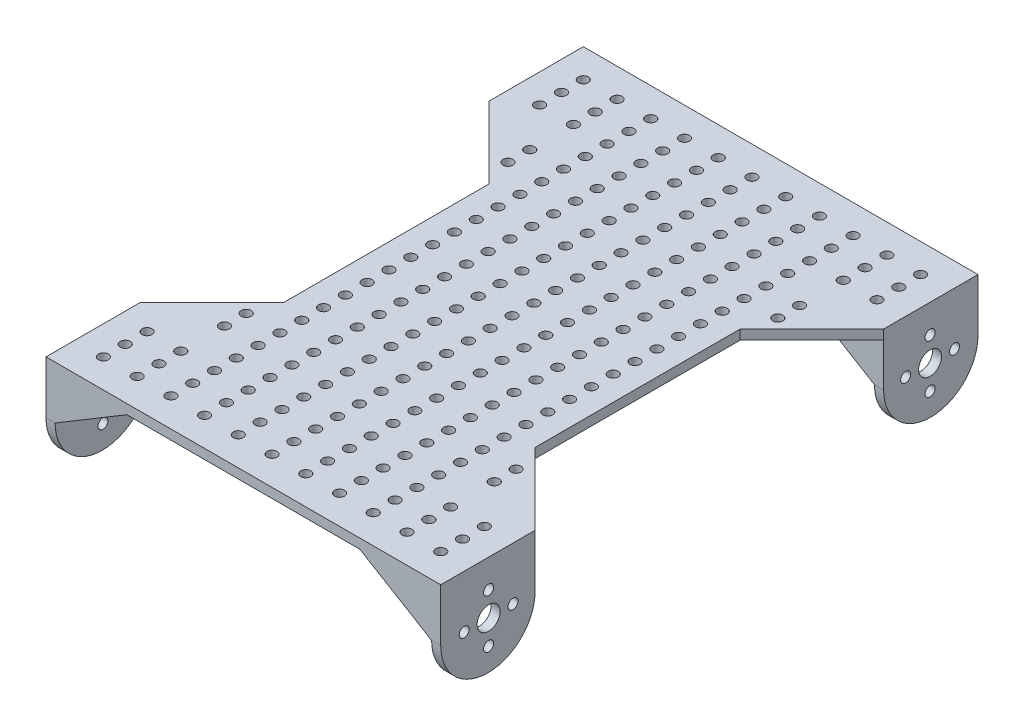
from build123d import *

# Parameters (mm, degrees)
CROQUIS1_R                   = 13.2
CROQUIS1_R_2                 = 4
CROQUIS1_R_3                 = 1.75
SALIENTE_EXTRUIR1_DEPTH      = 3.175
SALIENTE_EXTRUIR2_DEPTH      = 131.175
SALIENTE_EXTRUIR2_DEPTH_BACK = 3.175
CROQUIS3_W                   = 187.2
CROQUIS3_H                   = 3.36816026
CROQUIS4_R                   = 1.75
CROQUIS4_R_2                 = 4
SALIENTE_EXTRUIR3_DEPTH      = 3.175
CORTAR_EXTRUIR1_DEPTH        = 170.959965606
SALIENTE_EXTRUIR4_START      = -187.2
SALIENTE_EXTRUIR4_DEPTH      = 187.2
CORTAR_EXTRUIR2_START        = -65.5875
CROQUIS9_W                   = 26.9
CROQUIS9_H                   = 15
CROQUIS9_W_2                 = 121.4
CORTAR_EXTRUIR2_DEPTH        = 131.175
CROQUIS10_R                  = 1.75
CORTAR_EXTRUIR3_DEPTH        = 170.959965606


with BuildPart() as part:
    # Croquis1 → Saliente-Extruir1 (new body)
    # profile 1 of 3: a face of its own
    with BuildSketch(Plane(origin=(0, 0, 0), x_dir=(0, 0, -1), z_dir=(1, 0, 0))):
        with BuildLine():
            ThreePointArc((93.6, -15), (77.15, -31.45), (60.7, -15))
            Line((60.7, -15), (60.7, 0))
            Line((60.7, 0), (-60.7, 0))
            Line((-60.7, 0), (-60.7, -15))
            ThreePointArc((-60.7, -15), (-77.15, -31.45), (-93.6, -15))
            Line((-93.6, -15), (-93.6, 0))
            Line((-93.6, 0), (-93.6, 3.36816026))
            Line((-93.6, 3.36816026), (93.6, 3.36816026))
            Line((93.6, 3.36816026), (93.6, 0))
            Line((93.6, 0), (93.6, -15))
        make_face()
        with Locations((-76.9, -15)):
            Circle(CROQUIS1_R, mode=Mode.SUBTRACT)
        with Locations((76.9, -15)):
            Circle(CROQUIS1_R, mode=Mode.SUBTRACT)
    # profile 2 of 3: a face of its own
    with BuildSketch(Plane(origin=(0, 0, 0), x_dir=(0, 0, -1), z_dir=(1, 0, 0))):
        with Locations((-76.9, -15)):
            Circle(CROQUIS1_R)
        with Locations((-76.9, -15)):
            Circle(CROQUIS1_R_2, mode=Mode.SUBTRACT)
        with Locations((-76.9, -6.5)):
            Circle(CROQUIS1_R_3, mode=Mode.SUBTRACT)
        with Locations((-68.4, -15)):
            Circle(CROQUIS1_R_3, mode=Mode.SUBTRACT)
        with Locations((-85.4, -15)):
            Circle(CROQUIS1_R_3, mode=Mode.SUBTRACT)
        with Locations((-76.9, -23.5)):
            Circle(CROQUIS1_R_3, mode=Mode.SUBTRACT)
    # profile 3 of 3: a face of its own
    with BuildSketch(Plane(origin=(0, 0, 0), x_dir=(0, 0, -1), z_dir=(1, 0, 0))):
        with Locations((76.9, -15)):
            Circle(CROQUIS1_R)
        with Locations((76.9, -23.5)):
            Circle(CROQUIS1_R_3, mode=Mode.SUBTRACT)
        with Locations((68.4, -15)):
            Circle(CROQUIS1_R_3, mode=Mode.SUBTRACT)
        with Locations((76.9, -6.5)):
            Circle(CROQUIS1_R_3, mode=Mode.SUBTRACT)
        with Locations((85.4, -15)):
            Circle(CROQUIS1_R_3, mode=Mode.SUBTRACT)
        with Locations((76.9, -15)):
            Circle(CROQUIS1_R_2, mode=Mode.SUBTRACT)
    extrude(amount=SALIENTE_EXTRUIR1_DEPTH)

    # Croquis3 → Saliente-Extruir2 (add, two sides: drawn at the far end of the back side and taken through both)
    with BuildSketch(Plane(origin=(3.175, 0, 0), x_dir=(0, 0, -1), z_dir=(1, 0, 0)).offset(-SALIENTE_EXTRUIR2_DEPTH_BACK)):
        with Locations((0, 1.68408013)):
            Rectangle(CROQUIS3_W, CROQUIS3_H)
    extrude(amount=SALIENTE_EXTRUIR2_DEPTH + SALIENTE_EXTRUIR2_DEPTH_BACK)

    # Croquis4 → Saliente-Extruir3 (add)
    # profile 1 of 3: a face of its own
    with BuildSketch(Plane(origin=(134.35, 0, 0), x_dir=(0, 0, -1), z_dir=(1, 0, 0))):
        with BuildLine():
            Line((-60.7, 0), (-93.6, 0))
            Line((-93.6, 0), (-93.6, -15))
            ThreePointArc((-93.6, -15), (-77.15, -31.45), (-60.7, -15))
            Line((-60.7, -15), (-60.7, 0))
        make_face()
        with Locations((-76.9, -23.5)):
            Circle(CROQUIS4_R, mode=Mode.SUBTRACT)
        with Locations((-85.4, -15)):
            Circle(CROQUIS4_R, mode=Mode.SUBTRACT)
        with Locations((-76.9, -15)):
            Circle(CROQUIS4_R_2, mode=Mode.SUBTRACT)
        with Locations((-68.4, -15)):
            Circle(CROQUIS4_R, mode=Mode.SUBTRACT)
        with Locations((-76.9, -6.5)):
            Circle(CROQUIS4_R, mode=Mode.SUBTRACT)
    # profile 2 of 3: a face of its own
    with BuildSketch(Plane(origin=(134.35, 0, 0), x_dir=(0, 0, -1), z_dir=(1, 0, 0))):
        Polygon((93.6, 0), (93.6, 3.36816026), (-93.6, 3.36816026), (-93.6, 0), (-60.7, 0), (60.7, 0), align=None)
    # profile 3 of 3: a face of its own
    with BuildSketch(Plane(origin=(134.35, 0, 0), x_dir=(0, 0, -1), z_dir=(1, 0, 0))):
        with BuildLine():
            Line((93.6, -15), (93.6, 0))
            Line((93.6, 0), (60.7, 0))
            Line((60.7, 0), (60.7, -15))
            ThreePointArc((60.7, -15), (77.15, -31.45), (93.6, -15))
        make_face()
        with Locations((76.9, -23.5)):
            Circle(CROQUIS4_R, mode=Mode.SUBTRACT)
        with Locations((68.4, -15)):
            Circle(CROQUIS4_R, mode=Mode.SUBTRACT)
        with Locations((76.9, -15)):
            Circle(CROQUIS4_R_2, mode=Mode.SUBTRACT)
        with Locations((85.4, -15)):
            Circle(CROQUIS4_R, mode=Mode.SUBTRACT)
        with Locations((76.9, -6.5)):
            Circle(CROQUIS4_R, mode=Mode.SUBTRACT)
    extrude(amount=SALIENTE_EXTRUIR3_DEPTH)

    # Croquis5 → Cortar-Extruir1 (cut, through all)
    with BuildSketch(Plane(origin=(0, 3.36816026, 0), x_dir=(1, 0, 0), z_dir=(0, 1, 0))):
        Polygon((0, 60.7), (25, 35.7), (25, -35.7), (0, -60.7), align=None)
        Polygon((137.525, 60.7), (112.525, 35.7), (112.525, -35.7), (137.525, -60.7), align=None)
    extrude(amount=-CORTAR_EXTRUIR1_DEPTH, mode=Mode.SUBTRACT)

    # Croquis8 → Saliente-Extruir4 (add)
    with BuildSketch(Plane.XY.offset(93.6).offset(SALIENTE_EXTRUIR4_START)):
        Polygon((3.175, -15), (28.175, 0), (3.175, 0), align=None)
        Polygon((134.35, 0), (134.35, -15), (109.35, 0), align=None)
    extrude(amount=SALIENTE_EXTRUIR4_DEPTH)

    # Croquis9 → Cortar-Extruir2 (cut)
    with BuildSketch(Plane(origin=(68.7625, 0, 0), x_dir=(0, 0, -1), z_dir=(1, 0, 0)).offset(CORTAR_EXTRUIR2_START)):
        with Locations((-77.15, -7.5)):
            Rectangle(CROQUIS9_W, CROQUIS9_H)
        with Locations((0, -7.5)):
            Rectangle(CROQUIS9_W_2, CROQUIS9_H)
        with Locations((77.15, -7.5)):
            Rectangle(CROQUIS9_W, CROQUIS9_H)
    extrude(amount=CORTAR_EXTRUIR2_DEPTH, mode=Mode.SUBTRACT)

    # Croquis10 → Cortar-Extruir3 (cut, through all)
    with BuildSketch(Plane(origin=(0, 3.36816026, 0), x_dir=(1, 0, 0), z_dir=(0, 1, 0))):
        with Locations(Location((10, 83.6, 0), (0, 0, 270))):
            Circle(CROQUIS10_R)
        with Locations((127.525, 83.6)):
            Circle(CROQUIS10_R)
        with Locations(Location((21.753, 83.6, 0), (0, 0, 270))):
            Circle(CROQUIS10_R)
        with Locations(Location((33.506, 83.6, 0), (0, 0, 270))):
            Circle(CROQUIS10_R)
        with Locations(Location((45.259, 83.6, 0), (0, 0, 270))):
            Circle(CROQUIS10_R)
        with Locations(Location((57.012, 83.6, 0), (0, 0, 270))):
            Circle(CROQUIS10_R)
        with Locations(Location((68.765, 83.6, 0), (0, 0, 270))):
            Circle(CROQUIS10_R)
        with Locations(Location((80.518, 83.6, 0), (0, 0, 270))):
            Circle(CROQUIS10_R)
        with Locations(Location((92.271, 83.6, 0), (0, 0, 270))):
            Circle(CROQUIS10_R)
        with Locations(Location((104.024, 83.6, 0), (0, 0, 270))):
            Circle(CROQUIS10_R)
        with Locations(Location((115.777, 83.6, 0), (0, 0, 270))):
            Circle(CROQUIS10_R)
        with Locations((127.53, 83.6)):
            Circle(CROQUIS10_R)
        with Locations(Location((10, -83.6, 0), (0, 0, 270))):
            Circle(CROQUIS10_R)
        with Locations(Location((10, 76, 0), (0, 0, 270))):
            Circle(CROQUIS10_R)
        with Locations((127.525, 76)):
            Circle(CROQUIS10_R)
        with Locations(Location((21.753, 76, 0), (0, 0, 270))):
            Circle(CROQUIS10_R)
        with Locations(Location((33.506, 76, 0), (0, 0, 270))):
            Circle(CROQUIS10_R)
        with Locations(Location((45.259, 76, 0), (0, 0, 270))):
            Circle(CROQUIS10_R)
        with Locations(Location((57.012, 76, 0), (0, 0, 270))):
            Circle(CROQUIS10_R)
        with Locations(Location((68.765, 76, 0), (0, 0, 270))):
            Circle(CROQUIS10_R)
        with Locations(Location((80.518, 76, 0), (0, 0, 270))):
            Circle(CROQUIS10_R)
        with Locations(Location((92.271, 76, 0), (0, 0, 270))):
            Circle(CROQUIS10_R)
        with Locations(Location((104.024, 76, 0), (0, 0, 270))):
            Circle(CROQUIS10_R)
        with Locations(Location((115.777, 76, 0), (0, 0, 270))):
            Circle(CROQUIS10_R)
        with Locations((127.53, 76)):
            Circle(CROQUIS10_R)
        with Locations(Location((10, 68.4, 0), (0, 0, 270))):
            Circle(CROQUIS10_R)
        with Locations((127.525, 68.4)):
            Circle(CROQUIS10_R)
        with Locations(Location((21.753, 68.4, 0), (0, 0, 270))):
            Circle(CROQUIS10_R)
        with Locations(Location((33.506, 68.4, 0), (0, 0, 270))):
            Circle(CROQUIS10_R)
        with Locations(Location((45.259, 68.4, 0), (0, 0, 270))):
            Circle(CROQUIS10_R)
        with Locations(Location((57.012, 68.4, 0), (0, 0, 270))):
            Circle(CROQUIS10_R)
        with Locations(Location((68.765, 68.4, 0), (0, 0, 270))):
            Circle(CROQUIS10_R)
        with Locations(Location((80.518, 68.4, 0), (0, 0, 270))):
            Circle(CROQUIS10_R)
        with Locations(Location((92.271, 68.4, 0), (0, 0, 270))):
            Circle(CROQUIS10_R)
        with Locations(Location((104.024, 68.4, 0), (0, 0, 270))):
            Circle(CROQUIS10_R)
        with Locations(Location((115.777, 68.4, 0), (0, 0, 270))):
            Circle(CROQUIS10_R)
        with Locations((127.53, 68.4)):
            Circle(CROQUIS10_R)
        with Locations(Location((33.506, 60.8, 0), (0, 0, 270))):
            Circle(CROQUIS10_R)
        with Locations(Location((45.259, 60.8, 0), (0, 0, 270))):
            Circle(CROQUIS10_R)
        with Locations(Location((57.012, 60.8, 0), (0, 0, 270))):
            Circle(CROQUIS10_R)
        with Locations(Location((68.765, 60.8, 0), (0, 0, 270))):
            Circle(CROQUIS10_R)
        with Locations(Location((80.518, 60.8, 0), (0, 0, 270))):
            Circle(CROQUIS10_R)
        with Locations(Location((92.271, 60.8, 0), (0, 0, 270))):
            Circle(CROQUIS10_R)
        with Locations(Location((104.024, 60.8, 0), (0, 0, 270))):
            Circle(CROQUIS10_R)
        with Locations(Location((21.753, 53.2, 0), (0, 0, 270))):
            Circle(CROQUIS10_R)
        with Locations(Location((33.506, 53.2, 0), (0, 0, 270))):
            Circle(CROQUIS10_R)
        with Locations(Location((45.259, 53.2, 0), (0, 0, 270))):
            Circle(CROQUIS10_R)
        with Locations(Location((57.012, 53.2, 0), (0, 0, 270))):
            Circle(CROQUIS10_R)
        with Locations(Location((68.765, 53.2, 0), (0, 0, 270))):
            Circle(CROQUIS10_R)
        with Locations(Location((80.518, 53.2, 0), (0, 0, 270))):
            Circle(CROQUIS10_R)
        with Locations(Location((92.271, 53.2, 0), (0, 0, 270))):
            Circle(CROQUIS10_R)
        with Locations(Location((104.024, 53.2, 0), (0, 0, 270))):
            Circle(CROQUIS10_R)
        with Locations(Location((115.777, 53.2, 0), (0, 0, 270))):
            Circle(CROQUIS10_R)
        with Locations((10, 45.6)):
            Circle(CROQUIS10_R)
        with Locations((127.525, 45.6)):
            Circle(CROQUIS10_R)
        with Locations(Location((21.753, 45.6, 0), (0, 0, 270))):
            Circle(CROQUIS10_R)
        with Locations(Location((33.506, 45.6, 0), (0, 0, 270))):
            Circle(CROQUIS10_R)
        with Locations(Location((45.259, 45.6, 0), (0, 0, 270))):
            Circle(CROQUIS10_R)
        with Locations(Location((57.012, 45.6, 0), (0, 0, 270))):
            Circle(CROQUIS10_R)
        with Locations(Location((68.765, 45.6, 0), (0, 0, 270))):
            Circle(CROQUIS10_R)
        with Locations(Location((80.518, 45.6, 0), (0, 0, 270))):
            Circle(CROQUIS10_R)
        with Locations(Location((92.271, 45.6, 0), (0, 0, 270))):
            Circle(CROQUIS10_R)
        with Locations(Location((104.024, 45.6, 0), (0, 0, 270))):
            Circle(CROQUIS10_R)
        with Locations(Location((115.777, 45.6, 0), (0, 0, 270))):
            Circle(CROQUIS10_R)
        with Locations((127.53, 45.6)):
            Circle(CROQUIS10_R)
        with Locations((10, 38)):
            Circle(CROQUIS10_R)
        with Locations((127.525, 38)):
            Circle(CROQUIS10_R)
        with Locations(Location((33.506, 38, 0), (0, 0, 270))):
            Circle(CROQUIS10_R)
        with Locations(Location((45.259, 38, 0), (0, 0, 270))):
            Circle(CROQUIS10_R)
        with Locations(Location((57.012, 38, 0), (0, 0, 270))):
            Circle(CROQUIS10_R)
        with Locations(Location((68.765, 38, 0), (0, 0, 270))):
            Circle(CROQUIS10_R)
        with Locations(Location((80.518, 38, 0), (0, 0, 270))):
            Circle(CROQUIS10_R)
        with Locations(Location((92.271, 38, 0), (0, 0, 270))):
            Circle(CROQUIS10_R)
        with Locations(Location((104.024, 38, 0), (0, 0, 270))):
            Circle(CROQUIS10_R)
        with Locations((127.53, 38)):
            Circle(CROQUIS10_R)
        with Locations((10, 30.4)):
            Circle(CROQUIS10_R)
        with Locations((127.525, 30.4)):
            Circle(CROQUIS10_R)
        with Locations((21.753, 30.4)):
            Circle(CROQUIS10_R)
        with Locations(Location((33.506, 30.4, 0), (0, 0, 270))):
            Circle(CROQUIS10_R)
        with Locations(Location((45.259, 30.4, 0), (0, 0, 270))):
            Circle(CROQUIS10_R)
        with Locations(Location((57.012, 30.4, 0), (0, 0, 270))):
            Circle(CROQUIS10_R)
        with Locations(Location((68.765, 30.4, 0), (0, 0, 270))):
            Circle(CROQUIS10_R)
        with Locations(Location((80.518, 30.4, 0), (0, 0, 270))):
            Circle(CROQUIS10_R)
        with Locations(Location((92.271, 30.4, 0), (0, 0, 270))):
            Circle(CROQUIS10_R)
        with Locations(Location((104.024, 30.4, 0), (0, 0, 270))):
            Circle(CROQUIS10_R)
        with Locations((115.777, 30.4)):
            Circle(CROQUIS10_R)
        with Locations((127.53, 30.4)):
            Circle(CROQUIS10_R)
        with Locations((10, 22.8)):
            Circle(CROQUIS10_R)
        with Locations((127.525, 22.8)):
            Circle(CROQUIS10_R)
        with Locations((21.753, 22.8)):
            Circle(CROQUIS10_R)
        with Locations(Location((33.506, 22.8, 0), (0, 0, 270))):
            Circle(CROQUIS10_R)
        with Locations(Location((45.259, 22.8, 0), (0, 0, 270))):
            Circle(CROQUIS10_R)
        with Locations(Location((57.012, 22.8, 0), (0, 0, 270))):
            Circle(CROQUIS10_R)
        with Locations(Location((68.765, 22.8, 0), (0, 0, 270))):
            Circle(CROQUIS10_R)
        with Locations(Location((80.518, 22.8, 0), (0, 0, 270))):
            Circle(CROQUIS10_R)
        with Locations(Location((92.271, 22.8, 0), (0, 0, 270))):
            Circle(CROQUIS10_R)
        with Locations(Location((104.024, 22.8, 0), (0, 0, 270))):
            Circle(CROQUIS10_R)
        with Locations((115.777, 22.8)):
            Circle(CROQUIS10_R)
        with Locations((127.53, 22.8)):
            Circle(CROQUIS10_R)
        with Locations((10, 15.2)):
            Circle(CROQUIS10_R)
        with Locations((127.525, 15.2)):
            Circle(CROQUIS10_R)
        with Locations((21.753, 15.2)):
            Circle(CROQUIS10_R)
        with Locations(Location((33.506, 15.2, 0), (0, 0, 270))):
            Circle(CROQUIS10_R)
        with Locations(Location((45.259, 15.2, 0), (0, 0, 270))):
            Circle(CROQUIS10_R)
        with Locations(Location((57.012, 15.2, 0), (0, 0, 270))):
            Circle(CROQUIS10_R)
        with Locations(Location((68.765, 15.2, 0), (0, 0, 270))):
            Circle(CROQUIS10_R)
        with Locations(Location((80.518, 15.2, 0), (0, 0, 270))):
            Circle(CROQUIS10_R)
        with Locations(Location((92.271, 15.2, 0), (0, 0, 270))):
            Circle(CROQUIS10_R)
        with Locations(Location((104.024, 15.2, 0), (0, 0, 270))):
            Circle(CROQUIS10_R)
        with Locations((115.777, 15.2)):
            Circle(CROQUIS10_R)
        with Locations((127.53, 15.2)):
            Circle(CROQUIS10_R)
        with Locations((10, 7.6)):
            Circle(CROQUIS10_R)
        with Locations((127.525, 7.6)):
            Circle(CROQUIS10_R)
        with Locations((21.753, 7.6)):
            Circle(CROQUIS10_R)
        with Locations(Location((33.506, 7.6, 0), (0, 0, 270))):
            Circle(CROQUIS10_R)
        with Locations(Location((45.259, 7.6, 0), (0, 0, 270))):
            Circle(CROQUIS10_R)
        with Locations(Location((57.012, 7.6, 0), (0, 0, 270))):
            Circle(CROQUIS10_R)
        with Locations(Location((68.765, 7.6, 0), (0, 0, 270))):
            Circle(CROQUIS10_R)
        with Locations(Location((80.518, 7.6, 0), (0, 0, 270))):
            Circle(CROQUIS10_R)
        with Locations(Location((92.271, 7.6, 0), (0, 0, 270))):
            Circle(CROQUIS10_R)
        with Locations(Location((104.024, 7.6, 0), (0, 0, 270))):
            Circle(CROQUIS10_R)
        with Locations((115.777, 7.6)):
            Circle(CROQUIS10_R)
        with Locations((127.53, 7.6)):
            Circle(CROQUIS10_R)
        with Locations((10, 0)):
            Circle(CROQUIS10_R)
        with Locations((127.525, 0)):
            Circle(CROQUIS10_R)
        with Locations((21.753, 0)):
            Circle(CROQUIS10_R)
        with Locations(Location((33.506, 0, 0), (0, 0, 270))):
            Circle(CROQUIS10_R)
        with Locations(Location((45.259, 0, 0), (0, 0, 270))):
            Circle(CROQUIS10_R)
        with Locations(Location((57.012, 0, 0), (0, 0, 270))):
            Circle(CROQUIS10_R)
        with Locations(Location((68.765, 0, 0), (0, 0, 270))):
            Circle(CROQUIS10_R)
        with Locations(Location((80.518, 0, 0), (0, 0, 270))):
            Circle(CROQUIS10_R)
        with Locations(Location((92.271, 0, 0), (0, 0, 270))):
            Circle(CROQUIS10_R)
        with Locations(Location((104.024, 0, 0), (0, 0, 270))):
            Circle(CROQUIS10_R)
        with Locations((115.777, 0)):
            Circle(CROQUIS10_R)
        with Locations((127.53, 0)):
            Circle(CROQUIS10_R)
        with Locations((10, -7.6)):
            Circle(CROQUIS10_R)
        with Locations((127.525, -7.6)):
            Circle(CROQUIS10_R)
        with Locations((21.753, -7.6)):
            Circle(CROQUIS10_R)
        with Locations(Location((33.506, -7.6, 0), (0, 0, 270))):
            Circle(CROQUIS10_R)
        with Locations(Location((45.259, -7.6, 0), (0, 0, 270))):
            Circle(CROQUIS10_R)
        with Locations(Location((57.012, -7.6, 0), (0, 0, 270))):
            Circle(CROQUIS10_R)
        with Locations(Location((68.765, -7.6, 0), (0, 0, 270))):
            Circle(CROQUIS10_R)
        with Locations(Location((80.518, -7.6, 0), (0, 0, 270))):
            Circle(CROQUIS10_R)
        with Locations(Location((92.271, -7.6, 0), (0, 0, 270))):
            Circle(CROQUIS10_R)
        with Locations(Location((104.024, -7.6, 0), (0, 0, 270))):
            Circle(CROQUIS10_R)
        with Locations((115.777, -7.6)):
            Circle(CROQUIS10_R)
        with Locations((127.53, -7.6)):
            Circle(CROQUIS10_R)
        with Locations((10, -15.2)):
            Circle(CROQUIS10_R)
        with Locations((127.525, -15.2)):
            Circle(CROQUIS10_R)
        with Locations((21.753, -15.2)):
            Circle(CROQUIS10_R)
        with Locations(Location((33.506, -15.2, 0), (0, 0, 270))):
            Circle(CROQUIS10_R)
        with Locations(Location((45.259, -15.2, 0), (0, 0, 270))):
            Circle(CROQUIS10_R)
        with Locations(Location((57.012, -15.2, 0), (0, 0, 270))):
            Circle(CROQUIS10_R)
        with Locations(Location((68.765, -15.2, 0), (0, 0, 270))):
            Circle(CROQUIS10_R)
        with Locations(Location((80.518, -15.2, 0), (0, 0, 270))):
            Circle(CROQUIS10_R)
        with Locations(Location((92.271, -15.2, 0), (0, 0, 270))):
            Circle(CROQUIS10_R)
        with Locations(Location((104.024, -15.2, 0), (0, 0, 270))):
            Circle(CROQUIS10_R)
        with Locations((115.777, -15.2)):
            Circle(CROQUIS10_R)
        with Locations((127.53, -15.2)):
            Circle(CROQUIS10_R)
        with Locations((10, -22.8)):
            Circle(CROQUIS10_R)
        with Locations((127.525, -22.8)):
            Circle(CROQUIS10_R)
        with Locations((21.753, -22.8)):
            Circle(CROQUIS10_R)
        with Locations(Location((33.506, -22.8, 0), (0, 0, 270))):
            Circle(CROQUIS10_R)
        with Locations(Location((45.259, -22.8, 0), (0, 0, 270))):
            Circle(CROQUIS10_R)
        with Locations(Location((57.012, -22.8, 0), (0, 0, 270))):
            Circle(CROQUIS10_R)
        with Locations(Location((68.765, -22.8, 0), (0, 0, 270))):
            Circle(CROQUIS10_R)
        with Locations(Location((80.518, -22.8, 0), (0, 0, 270))):
            Circle(CROQUIS10_R)
        with Locations(Location((92.271, -22.8, 0), (0, 0, 270))):
            Circle(CROQUIS10_R)
        with Locations(Location((104.024, -22.8, 0), (0, 0, 270))):
            Circle(CROQUIS10_R)
        with Locations((115.777, -22.8)):
            Circle(CROQUIS10_R)
        with Locations((127.53, -22.8)):
            Circle(CROQUIS10_R)
        with Locations((10, -30.4)):
            Circle(CROQUIS10_R)
        with Locations((127.525, -30.4)):
            Circle(CROQUIS10_R)
        with Locations((21.753, -30.4)):
            Circle(CROQUIS10_R)
        with Locations(Location((33.506, -30.4, 0), (0, 0, 270))):
            Circle(CROQUIS10_R)
        with Locations(Location((45.259, -30.4, 0), (0, 0, 270))):
            Circle(CROQUIS10_R)
        with Locations(Location((57.012, -30.4, 0), (0, 0, 270))):
            Circle(CROQUIS10_R)
        with Locations(Location((68.765, -30.4, 0), (0, 0, 270))):
            Circle(CROQUIS10_R)
        with Locations(Location((80.518, -30.4, 0), (0, 0, 270))):
            Circle(CROQUIS10_R)
        with Locations(Location((92.271, -30.4, 0), (0, 0, 270))):
            Circle(CROQUIS10_R)
        with Locations(Location((104.024, -30.4, 0), (0, 0, 270))):
            Circle(CROQUIS10_R)
        with Locations((115.777, -30.4)):
            Circle(CROQUIS10_R)
        with Locations((127.53, -30.4)):
            Circle(CROQUIS10_R)
        with Locations((10, -38)):
            Circle(CROQUIS10_R)
        with Locations((127.525, -38)):
            Circle(CROQUIS10_R)
        with Locations(Location((33.506, -38, 0), (0, 0, 270))):
            Circle(CROQUIS10_R)
        with Locations(Location((45.259, -38, 0), (0, 0, 270))):
            Circle(CROQUIS10_R)
        with Locations(Location((57.012, -38, 0), (0, 0, 270))):
            Circle(CROQUIS10_R)
        with Locations(Location((68.765, -38, 0), (0, 0, 270))):
            Circle(CROQUIS10_R)
        with Locations(Location((80.518, -38, 0), (0, 0, 270))):
            Circle(CROQUIS10_R)
        with Locations(Location((92.271, -38, 0), (0, 0, 270))):
            Circle(CROQUIS10_R)
        with Locations(Location((104.024, -38, 0), (0, 0, 270))):
            Circle(CROQUIS10_R)
        with Locations((127.53, -38)):
            Circle(CROQUIS10_R)
        with Locations((10, -45.6)):
            Circle(CROQUIS10_R)
        with Locations((127.525, -45.6)):
            Circle(CROQUIS10_R)
        with Locations(Location((21.753, -45.6, 0), (0, 0, 270))):
            Circle(CROQUIS10_R)
        with Locations(Location((33.506, -45.6, 0), (0, 0, 270))):
            Circle(CROQUIS10_R)
        with Locations(Location((45.259, -45.6, 0), (0, 0, 270))):
            Circle(CROQUIS10_R)
        with Locations(Location((57.012, -45.6, 0), (0, 0, 270))):
            Circle(CROQUIS10_R)
        with Locations(Location((68.765, -45.6, 0), (0, 0, 270))):
            Circle(CROQUIS10_R)
        with Locations(Location((80.518, -45.6, 0), (0, 0, 270))):
            Circle(CROQUIS10_R)
        with Locations(Location((92.271, -45.6, 0), (0, 0, 270))):
            Circle(CROQUIS10_R)
        with Locations(Location((104.024, -45.6, 0), (0, 0, 270))):
            Circle(CROQUIS10_R)
        with Locations(Location((115.777, -45.6, 0), (0, 0, 270))):
            Circle(CROQUIS10_R)
        with Locations((127.53, -45.6)):
            Circle(CROQUIS10_R)
        with Locations(Location((21.753, -53.2, 0), (0, 0, 270))):
            Circle(CROQUIS10_R)
        with Locations(Location((33.506, -53.2, 0), (0, 0, 270))):
            Circle(CROQUIS10_R)
        with Locations(Location((45.259, -53.2, 0), (0, 0, 270))):
            Circle(CROQUIS10_R)
        with Locations(Location((57.012, -53.2, 0), (0, 0, 270))):
            Circle(CROQUIS10_R)
        with Locations(Location((68.765, -53.2, 0), (0, 0, 270))):
            Circle(CROQUIS10_R)
        with Locations(Location((80.518, -53.2, 0), (0, 0, 270))):
            Circle(CROQUIS10_R)
        with Locations(Location((92.271, -53.2, 0), (0, 0, 270))):
            Circle(CROQUIS10_R)
        with Locations(Location((104.024, -53.2, 0), (0, 0, 270))):
            Circle(CROQUIS10_R)
        with Locations(Location((115.777, -53.2, 0), (0, 0, 270))):
            Circle(CROQUIS10_R)
        with Locations(Location((33.506, -60.8, 0), (0, 0, 270))):
            Circle(CROQUIS10_R)
        with Locations(Location((45.259, -60.8, 0), (0, 0, 270))):
            Circle(CROQUIS10_R)
        with Locations(Location((57.012, -60.8, 0), (0, 0, 270))):
            Circle(CROQUIS10_R)
        with Locations(Location((68.765, -60.8, 0), (0, 0, 270))):
            Circle(CROQUIS10_R)
        with Locations(Location((80.518, -60.8, 0), (0, 0, 270))):
            Circle(CROQUIS10_R)
        with Locations(Location((92.271, -60.8, 0), (0, 0, 270))):
            Circle(CROQUIS10_R)
        with Locations(Location((104.024, -60.8, 0), (0, 0, 270))):
            Circle(CROQUIS10_R)
        with Locations(Location((10, -68.4, 0), (0, 0, 270))):
            Circle(CROQUIS10_R)
        with Locations((127.525, -68.4)):
            Circle(CROQUIS10_R)
        with Locations(Location((21.753, -68.4, 0), (0, 0, 270))):
            Circle(CROQUIS10_R)
        with Locations(Location((33.506, -68.4, 0), (0, 0, 270))):
            Circle(CROQUIS10_R)
        with Locations(Location((45.259, -68.4, 0), (0, 0, 270))):
            Circle(CROQUIS10_R)
        with Locations(Location((57.012, -68.4, 0), (0, 0, 270))):
            Circle(CROQUIS10_R)
        with Locations(Location((68.765, -68.4, 0), (0, 0, 270))):
            Circle(CROQUIS10_R)
        with Locations(Location((80.518, -68.4, 0), (0, 0, 270))):
            Circle(CROQUIS10_R)
        with Locations(Location((92.271, -68.4, 0), (0, 0, 270))):
            Circle(CROQUIS10_R)
        with Locations(Location((104.024, -68.4, 0), (0, 0, 270))):
            Circle(CROQUIS10_R)
        with Locations(Location((115.777, -68.4, 0), (0, 0, 270))):
            Circle(CROQUIS10_R)
        with Locations((127.53, -68.4)):
            Circle(CROQUIS10_R)
        with Locations(Location((10, -76, 0), (0, 0, 270))):
            Circle(CROQUIS10_R)
        with Locations((127.525, -76)):
            Circle(CROQUIS10_R)
        with Locations(Location((21.753, -76, 0), (0, 0, 270))):
            Circle(CROQUIS10_R)
        with Locations(Location((33.506, -76, 0), (0, 0, 270))):
            Circle(CROQUIS10_R)
        with Locations(Location((45.259, -76, 0), (0, 0, 270))):
            Circle(CROQUIS10_R)
        with Locations(Location((57.012, -76, 0), (0, 0, 270))):
            Circle(CROQUIS10_R)
        with Locations(Location((68.765, -76, 0), (0, 0, 270))):
            Circle(CROQUIS10_R)
        with Locations(Location((80.518, -76, 0), (0, 0, 270))):
            Circle(CROQUIS10_R)
        with Locations(Location((92.271, -76, 0), (0, 0, 270))):
            Circle(CROQUIS10_R)
        with Locations(Location((104.024, -76, 0), (0, 0, 270))):
            Circle(CROQUIS10_R)
        with Locations(Location((115.777, -76, 0), (0, 0, 270))):
            Circle(CROQUIS10_R)
        with Locations((127.53, -76)):
            Circle(CROQUIS10_R)
        with Locations((127.525, -83.6)):
            Circle(CROQUIS10_R)
        with Locations(Location((21.753, -83.6, 0), (0, 0, 270))):
            Circle(CROQUIS10_R)
        with Locations(Location((33.506, -83.6, 0), (0, 0, 270))):
            Circle(CROQUIS10_R)
        with Locations(Location((45.259, -83.6, 0), (0, 0, 270))):
            Circle(CROQUIS10_R)
        with Locations(Location((57.012, -83.6, 0), (0, 0, 270))):
            Circle(CROQUIS10_R)
        with Locations(Location((68.765, -83.6, 0), (0, 0, 270))):
            Circle(CROQUIS10_R)
        with Locations(Location((80.518, -83.6, 0), (0, 0, 270))):
            Circle(CROQUIS10_R)
        with Locations(Location((92.271, -83.6, 0), (0, 0, 270))):
            Circle(CROQUIS10_R)
        with Locations(Location((104.024, -83.6, 0), (0, 0, 270))):
            Circle(CROQUIS10_R)
        with Locations(Location((115.777, -83.6, 0), (0, 0, 270))):
            Circle(CROQUIS10_R)
        with Locations((127.53, -83.6)):
            Circle(CROQUIS10_R)
    extrude(amount=-CORTAR_EXTRUIR3_DEPTH, mode=Mode.SUBTRACT)


solid = part.part
